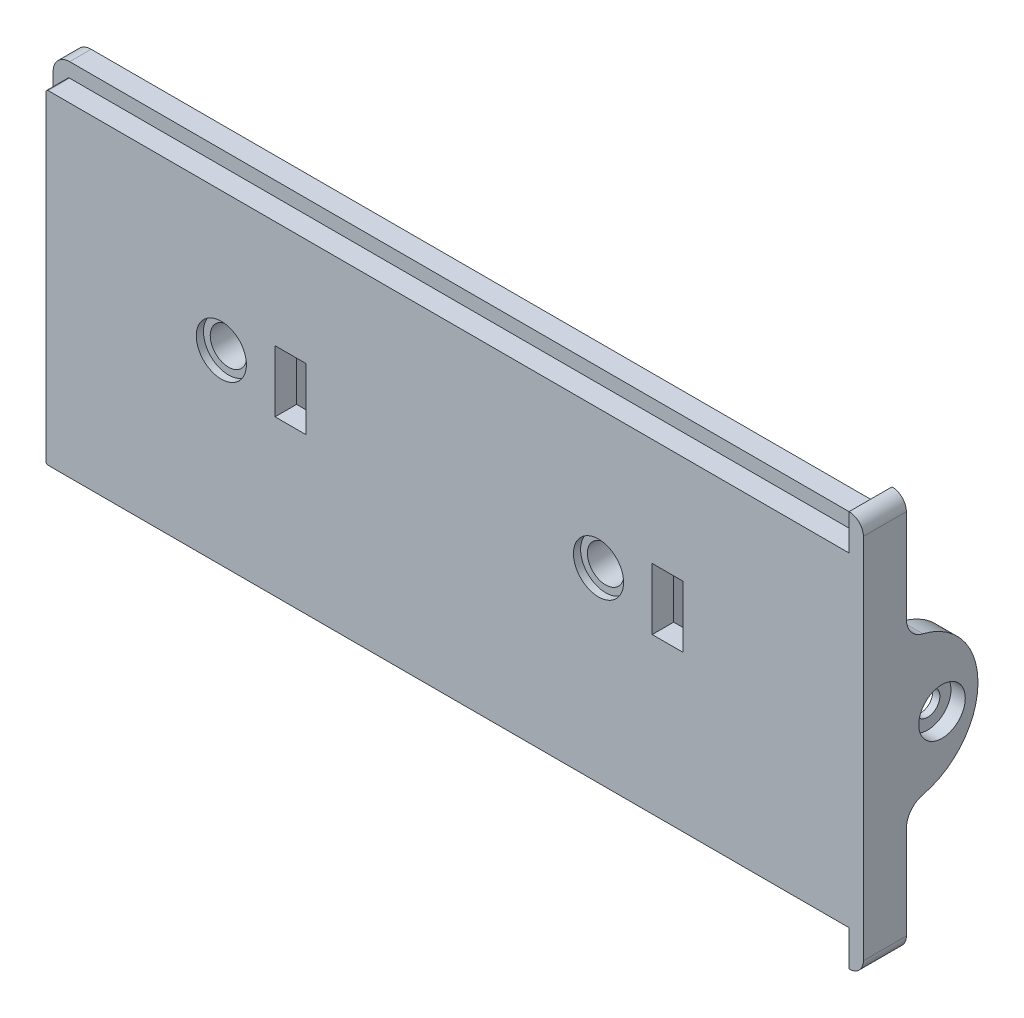
from build123d import *
from build123d.topology import SkipClean

# Parameters (mm, degrees)
SKETCH1_R                                   = 2.55
SKETCH1_W                                   = 4.3
SKETCH1_H                                   = 8.6
BOSS_EXTRUDE1_DEPTH                         = 3
SKETCH2_R                                   = 3.5
CUT_EXTRUDE1_DEPTH                          = 1
BOSS_EXTRUDE2_START                         = 5
SKETCH3_R                                   = 3.55
SKETCH3_R_2                                 = 2.55
BOSS_EXTRUDE2_DEPTH                         = 5
SKETCH7_W                                   = 2
SKETCH7_H                                   = 15
BOSS_EXTRUDE4_DEPTH                         = 5
SKETCH16_W                                  = 106.1
SKETCH16_H                                  = 42.3
BOSS_EXTRUDE9_DEPTH                         = 3
BOSS_EXTRUDE10_START                        = -6
BOSS_EXTRUDE10_DEPTH                        = 6
FILLET1_R                                   = 2
BOSS_EXTRUDE11_DEPTH                        = 3
FILLET2_R                                   = 3
CBORE_FOR_M3_CHEESE_HEAD_SCREW1_D           = 3.4
CBORE_FOR_M3_CHEESE_HEAD_SCREW1_CBORE_D     = 6.5
CBORE_FOR_M3_CHEESE_HEAD_SCREW1_CBORE_DEPTH = 2
SKETCH20_W                                  = 3
SKETCH20_H                                  = 2
CUT_EXTRUDE3_DEPTH                          = 8


with BuildPart() as part:
    # Sketch1 → Boss-Extrude1 (new body)
    with BuildSketch(Plane.XY):
        with BuildLine():
            Line((-54.25, 22.65), (-37.75, 22.65))
            Line((-37.75, 22.65), (-7.55, 22.65))
            Line((-7.55, 22.65), (7.55, 22.65))
            Line((7.55, 22.65), (37.75, 22.65))
            Line((37.75, 22.65), (54.25, 22.65))
            ThreePointArc((54.25, 22.65), (54.462132034, 22.562132034), (54.55, 22.35))
            Line((54.55, 22.35), (54.55, 12.1))
            Line((54.55, 12.1), (54.55, -18.1))
            Line((54.55, -18.1), (54.55, -22.35))
            ThreePointArc((54.55, -22.35), (54.462132034, -22.562132034), (54.25, -22.65))
            Line((54.25, -22.65), (39.65, -22.65))
            Line((39.65, -22.65), (9.45, -22.65))
            Line((9.45, -22.65), (-9.45, -22.65))
            Line((-9.45, -22.65), (-39.65, -22.65))
            Line((-39.65, -22.65), (-54.25, -22.65))
            ThreePointArc((-54.25, -22.65), (-54.462132034, -22.562132034), (-54.55, -22.35))
            Line((-54.55, -22.35), (-54.55, -18.1))
            Line((-54.55, -18.1), (-54.55, 12.1))
            Line((-54.55, 12.1), (-54.55, 22.35))
            ThreePointArc((-54.55, 22.35), (-54.462132034, 22.562132034), (-54.25, 22.65))
        make_face()
        with Locations((-30.075, 3.35)):
            Circle(SKETCH1_R, mode=Mode.SUBTRACT)
        with Locations((22.575, 3.35)):
            Circle(SKETCH1_R, mode=Mode.SUBTRACT)
        with Locations((32.225, 3.35)):
            Rectangle(SKETCH1_W, SKETCH1_H, mode=Mode.SUBTRACT)
        with Locations((-20.425, 3.35)):
            Rectangle(SKETCH1_W, SKETCH1_H, mode=Mode.SUBTRACT)
    extrude(amount=BOSS_EXTRUDE1_DEPTH)

    # Sketch2 → Cut-Extrude1 (cut)
    with BuildSketch(Plane.XY.offset(3)):
        with Locations((-30.075, 3.35)):
            Circle(SKETCH2_R)
        with Locations((22.575, 3.35)):
            Circle(SKETCH2_R)
    extrude(amount=-CUT_EXTRUDE1_DEPTH, mode=Mode.SUBTRACT)

    # Sketch3 → Boss-Extrude2 (add)
    # profile 1 of 2: a face of its own
    with BuildSketch(Plane(origin=(0, 0, 0), x_dir=(-1, 0, 0), z_dir=(0, 0, -1)).offset(BOSS_EXTRUDE2_START)):
        with Locations((-22.575, 3.35)):
            Circle(SKETCH3_R)
        with Locations((-22.575, 3.35)):
            Circle(SKETCH3_R_2, mode=Mode.SUBTRACT)
    # profile 2 of 2: a face of its own
    with BuildSketch(Plane(origin=(0, 0, 0), x_dir=(-1, 0, 0), z_dir=(0, 0, -1)).offset(BOSS_EXTRUDE2_START)):
        with Locations((30.075, 3.35)):
            Circle(SKETCH3_R)
        with Locations((30.075, 3.35)):
            Circle(SKETCH3_R_2, mode=Mode.SUBTRACT)
    extrude(amount=-BOSS_EXTRUDE2_DEPTH)

    # Sketch7 → Boss-Extrude4 (add)
    with BuildSketch(Plane(origin=(0, 0, 0), x_dir=(-1, 0, 0), z_dir=(0, 0, -1))):
        with Locations((-27.525, 3.4)):
            Rectangle(SKETCH7_W, SKETCH7_H)
        with Locations((-36.925, 3.4)):
            Rectangle(SKETCH7_W, SKETCH7_H)
        with Locations((25.125, 3.4)):
            Rectangle(SKETCH7_W, SKETCH7_H)
        with Locations((15.725, 3.4)):
            Rectangle(SKETCH7_W, SKETCH7_H)
    extrude(amount=BOSS_EXTRUDE4_DEPTH)

    # Sketch16 → Boss-Extrude9 (add)
    with BuildSketch(Plane(origin=(0, 0, 0), x_dir=(-1, 0, 0), z_dir=(0, 0, -1))):
        with BuildLine():
            Line((54.25, 24.65), (-54.25, 24.65))
            ThreePointArc((-54.25, 24.65), (-55.876345597, 23.976345597), (-56.55, 22.35))
            Line((-56.55, 22.35), (-56.55, -22.35))
            ThreePointArc((-56.55, -22.35), (-55.876345597, -23.976345597), (-54.25, -24.65))
            Line((-54.25, -24.65), (54.25, -24.65))
            ThreePointArc((54.25, -24.65), (55.876345597, -23.976345597), (56.55, -22.35))
            Line((56.55, -22.35), (56.55, 22.35))
            ThreePointArc((56.55, 22.35), (55.876345597, 23.976345597), (54.25, 24.65))
        make_face()
        Rectangle(SKETCH16_W, SKETCH16_H, mode=Mode.SUBTRACT)
    extrude(amount=BOSS_EXTRUDE9_DEPTH)

    # Sketch17 → Boss-Extrude10 (add)
    with BuildSketch(Plane.XY.offset(3).offset(BOSS_EXTRUDE10_START)):
        Polygon((49.55, -24.65), (57.55, -24.65), (57.55, -27.65), (59.55, -27.65), (59.55, -24.65), (59.55, 24.65), (59.55, 27.65), (57.55, 27.65), (57.55, 24.65), (49.55, 24.65), align=None)
    extrude(amount=BOSS_EXTRUDE10_DEPTH)

    # Fillet1
    fillet1_edges = [part.edges().sort_by_distance(p)[0] for p in [
        (59.55, 27.65, 0),
        (59.55, -27.65, 0),
    ]]
    fillet(fillet1_edges, radius=FILLET1_R - 0.0001)  # a hair under: the kernel refuses the full size

    # Sketch18 → Boss-Extrude11 (add)
    with BuildSketch(Plane(origin=(59.55, 0, 0), x_dir=(0, 0, -1), z_dir=(1, 0, 0))):
        with BuildLine():
            Line((3, -10), (3, 10))
            ThreePointArc((3, 10), (13, 0), (3, -10))
        make_face()
    extrude(amount=-BOSS_EXTRUDE11_DEPTH)

    # Fillet2
    fillet2_edges = [part.edges().sort_by_distance(p)[0] for p in [
        (58.05, 10, -3),
        (58.05, -10, -3),
    ]]
    fillet(fillet2_edges, radius=FILLET2_R)

    # CBORE for M3 Cheese Head Screw1 (through all)
    with Locations(Plane(origin=(59.55, -0.99503719, -7.975185951), x_dir=(0, 0, 1), z_dir=(1, 0, 0))):
        with Locations((0, 0)):
            CounterBoreHole(CBORE_FOR_M3_CHEESE_HEAD_SCREW1_D / 2, CBORE_FOR_M3_CHEESE_HEAD_SCREW1_CBORE_D / 2, CBORE_FOR_M3_CHEESE_HEAD_SCREW1_CBORE_DEPTH)

    # Sketch20 → Cut-Extrude3 (cut)
    with SkipClean():  # the faces are left unmerged after this step: merging them gives an invalid solid
        with BuildSketch(Plane.ZY.offset(-49.55)):
            with Locations((1.5, -23.65)):
                Rectangle(SKETCH20_W, SKETCH20_H)
            with Locations((1.5, 23.65)):
                Rectangle(SKETCH20_W, SKETCH20_H)
        extrude(amount=-CUT_EXTRUDE3_DEPTH, mode=Mode.SUBTRACT)
    add(part.part.scale(1), mode=Mode.REPLACE)  # the faces are merged on a copy


solid = part.part
